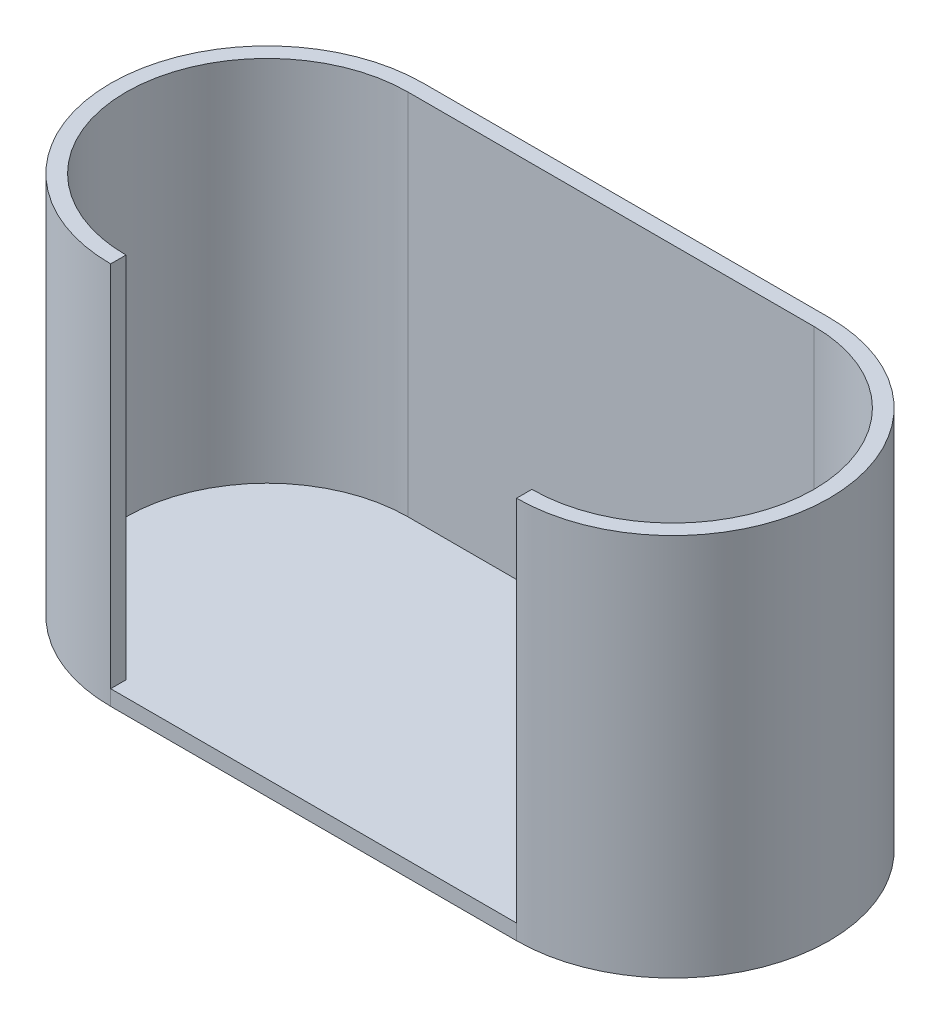
from build123d import *

# Parameters (mm, degrees)
BOSS_EXTRUDE1_DEPTH = 50
SHELL2_START        = 2
SHELL2_DEPTH        = 48


# Read off the part's stored shape, not the designer's step: Shell2
with BuildPart() as part:
    # Sketch1 → Boss-Extrude1 (new body)
    with BuildSketch(Plane(origin=(0, 0, 0), x_dir=(1, 0, 0), z_dir=(0, 1, 0))):
        with BuildLine():
            Line((-26.477298014, 20.407046949), (26.477298014, 20.407046949))
            ThreePointArc((26.477298014, 20.407046949), (46.884344963, 0), (26.477298014, -20.407046949))
            Line((26.477298014, -20.407046949), (-26.477298014, -20.407046949))
            ThreePointArc((-26.477298014, -20.407046949), (-46.884344963, 0), (-26.477298014, 20.407046949))
        make_face()
    extrude(amount=BOSS_EXTRUDE1_DEPTH)

    # Shell2 outline → Shell2 (cut)
    with BuildSketch(Plane(origin=(0, 0, 0), x_dir=(1, 0, 0), z_dir=(0, 1, 0)).offset(SHELL2_START)):
        with BuildLine():
            Line((-26.477298014, -18.407046949), (-26.477298014, -20.407046949))
            Line((-26.477298014, -20.407046949), (26.477298014, -20.407046949))
            Line((26.477298014, -20.407046949), (26.477298014, -18.407046949))
            ThreePointArc((26.477298014, -18.407046949), (44.884344963, 0), (26.477298014, 18.407046949))
            Line((26.477298014, 18.407046949), (-26.477298014, 18.407046949))
            ThreePointArc((-26.477298014, 18.407046949), (-44.884344963, 0), (-26.477298014, -18.407046949))
        make_face()
    extrude(amount=SHELL2_DEPTH, mode=Mode.SUBTRACT)


solid = part.part
